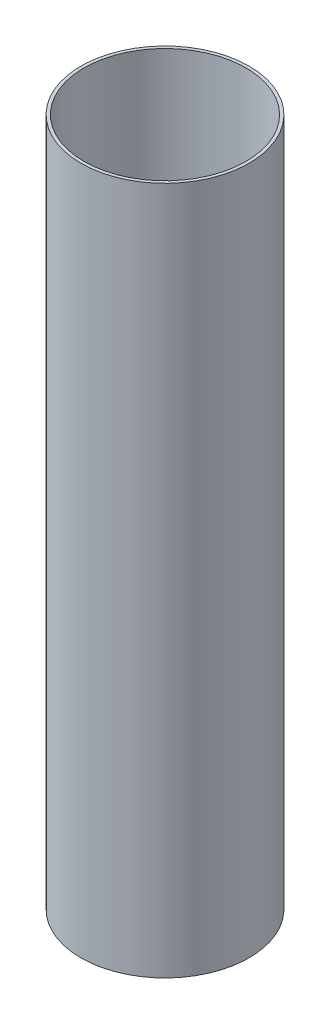
from build123d import *

# Parameters (mm, degrees)
SKETCH1_R           = 55
SKETCH1_R_2         = 53
BOSS_EXTRUDE1_DEPTH = 450


with BuildPart() as part:
    # Sketch1 → Boss-Extrude1 (new body)
    with BuildSketch(Plane(origin=(0, 0, 0), x_dir=(1, 0, 0), z_dir=(0, 1, 0))):
        Circle(SKETCH1_R)
        Circle(SKETCH1_R_2, mode=Mode.SUBTRACT)
    extrude(amount=BOSS_EXTRUDE1_DEPTH)


solid = part.part
